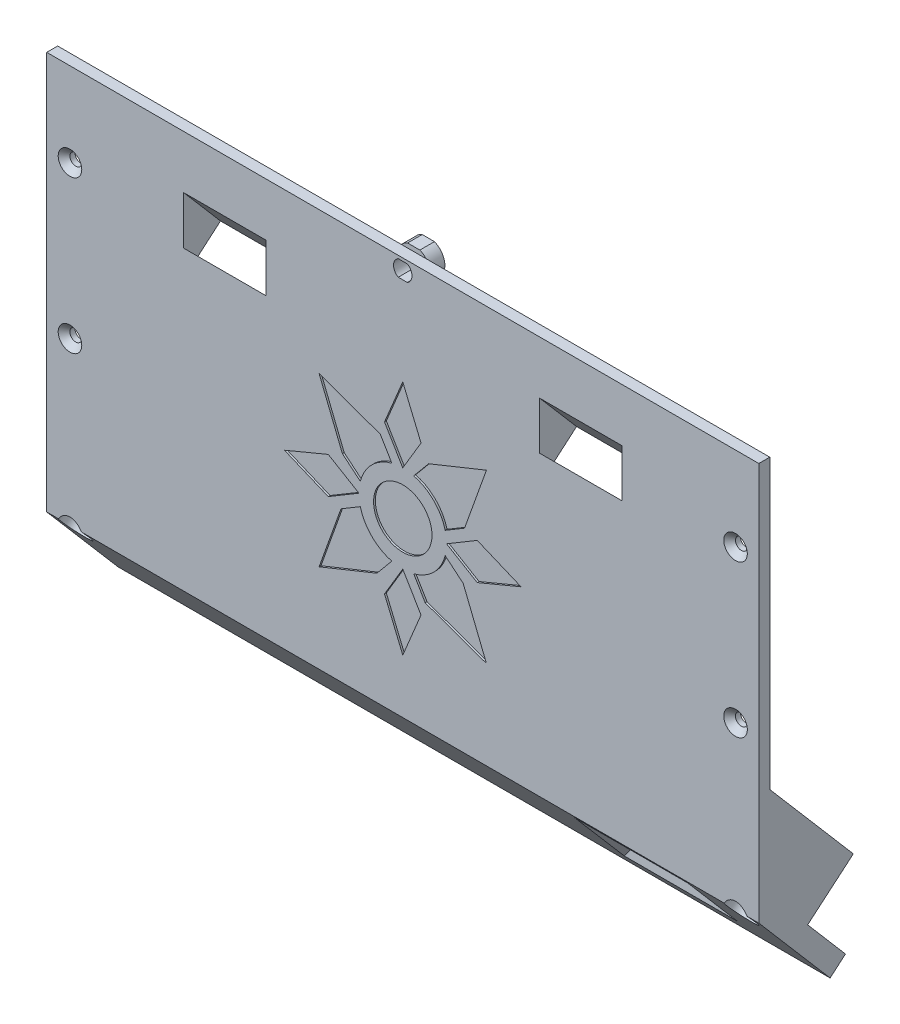
from build123d import *

# Parameters (mm, degrees)
CROQUIS1_W                  = 195
CROQUIS1_H                  = 38
CROQUIS1_R                  = 1.625
SALIENTE_EXTRUIR1_DEPTH     = 3
CROQUIS8_W                  = 195
CROQUIS8_H                  = 3
SALIENTE_EXTRUIR5_DEPTH     = 5
CROQUIS9_W                  = 195
CROQUIS9_H                  = 3
SALIENTE_EXTRUIR6_DEPTH     = 5
SALIENTE_EXTRUIR7_START     = -35
SALIENTE_EXTRUIR7_DEPTH     = 35
CORTAR_EXTRUIR4_DEPTH       = 106.249773968
CORTAR_EXTRUIR4_DEPTH_BACK  = 106.249773968
CROQUIS11_W                 = 22.5
CROQUIS11_H                 = 8.5
CORTAR_EXTRUIR5_REACH       = 168.049
CROQUIS13_R                 = 1
CORTAR_EXTRUIR6_DEPTH       = 5
SALIENTE_EXTRUIR8_START     = -35
SALIENTE_EXTRUIR8_DEPTH     = 35
CORTAR_EXTRUIR7_DEPTH       = 105.027363957
CORTAR_EXTRUIR7_DEPTH_BACK  = 105.027363957
CROQUIS16_W                 = 22.5
CROQUIS16_H                 = 8.572274099
CROQUIS17_R                 = 1
CORTAR_EXTRUIR8_DEPTH       = 5
CROQUIS18_R                 = 1.625
CORTAR_EXTRUIR9_DEPTH       = 10
CROQUIS19_W                 = 195
CROQUIS19_H                 = 24
SALIENTE_EXTRUIR9_DEPTH     = 3
CROQUIS20_W                 = 195
CROQUIS20_H                 = 28.69
SALIENTE_EXTRUIR10_DEPTH    = 3
CROQUIS22_W                 = 195
CROQUIS22_H                 = 8.799275258
CROQUIS22_W_2               = 10.817472397
CROQUIS22_H_2               = 9.408992843
CROQUIS22_W_3               = 11.057059306
SALIENTE_EXTRUIR11_DEPTH    = 3
CROQUIS23_R                 = 1.625
CORTAR_EXTRUIR10_DEPTH      = 10
CORTAR_EXTRUIR11_DEPTH      = 202.915168907
CORTAR_EXTRUIR11_DEPTH_BACK = 202.915168907
CROQUIS25_W                 = 6.04831912
CROQUIS25_H                 = 14.575165693
SALIENTE_EXTRUIR15_DEPTH    = 12.75
SALIENTE_EXTRUIR16_DEPTH    = 12.75
CROQUIS27_W                 = 3
CROQUIS27_H                 = 30
SALIENTE_EXTRUIR13_DEPTH    = 195
SALIENTE_EXTRUIR14_DEPTH    = 195
CORTAR_EXTRUIR12_DEPTH      = 125.253856914
CORTAR_EXTRUIR12_DEPTH_BACK = 125.253856914
CROQUIS31_R                 = 1.625
SALIENTE_EXTRUIR17_DEPTH    = 12.75
SALIENTE_EXTRUIR18_DEPTH    = 12.75
CORTAR_EXTRUIR15_DEPTH      = 125.560379507
CORTAR_EXTRUIR15_DEPTH_BACK = 125.560379507
CROQUIS39_R                 = 1.625
CORTAR_EXTRUIR16_START      = -4
CROQUIS40_R                 = 4
CORTAR_EXTRUIR16_DEPTH      = 121.560379507
SALIENTE_EXTRUIR19_START    = -15
SALIENTE_EXTRUIR19_DEPTH    = 4
CHAFL_N1_SIZE               = 10
SALIENTE_EXTRUIR20_DEPTH    = 3
CORTAR_EXTRUIR17_REACH      = 139.659
CROQUIS47_W                 = 25
CROQUIS47_H                 = 15
CORTAR_EXTRUIR18_REACH      = 132.012
CROQUIS49_R                 = 8
CORTAR_EXTRUIR19_DEPTH      = 0.5
CHAFL_N2_SIZE               = 3
SALIENTE_EXTRUIR22_DEPTH    = 4
CHAFL_N3_SIZE               = 1.6


with BuildPart() as part:
    # Croquis1 → Saliente-Extruir1 (new body)
    with BuildSketch(Plane.XY):
        with Locations((0, 19)):
            Rectangle(CROQUIS1_W, CROQUIS1_H)
        with Locations((91.125, 15)):
            Circle(CROQUIS1_R, mode=Mode.SUBTRACT)
        with Locations(Location((-91.125, 15, 0), (0, 0, 180))):
            Circle(CROQUIS1_R, mode=Mode.SUBTRACT)
    extrude(amount=SALIENTE_EXTRUIR1_DEPTH)

    # Croquis8 → Saliente-Extruir5 (add)
    with BuildSketch(Plane.XZ):
        with Locations((0, 1.5)):
            Rectangle(CROQUIS8_W, CROQUIS8_H)
    extrude(amount=SALIENTE_EXTRUIR5_DEPTH)

    # Croquis9 → Saliente-Extruir6 (add)
    with BuildSketch(Plane(origin=(0, 38, 0), x_dir=(1, 0, 0), z_dir=(0, 1, 0))):
        with Locations((0, -1.5)):
            Rectangle(CROQUIS9_W, CROQUIS9_H)
    extrude(amount=SALIENTE_EXTRUIR6_DEPTH)

    # Croquis10 → Saliente-Extruir7 (add)
    with BuildSketch(Plane(origin=(97.5, 0, 0), x_dir=(0, 0, -1), z_dir=(1, 0, 0)).offset(SALIENTE_EXTRUIR7_START)):
        Polygon((0, 35.316843742), (11.100559408, 22.365598856), (1.230032412, 13.905534031), (0, 12.851268747), align=None)
    extrude(amount=-SALIENTE_EXTRUIR7_DEPTH)

    # Croquis11 → Cortar-Extruir4 (cut, two sides: drawn at the far end of the back side and taken through both)
    with BuildSketch(Plane(origin=(0, 7.408665422, 6.349994257), x_dir=(1, 0, 0), z_dir=(0, -0.7592713073348797, -0.6507742172658522)).offset(-CORTAR_EXTRUIR4_DEPTH_BACK)):
        with Locations((48.75, -17.733291342)):
            Rectangle(CROQUIS11_W, CROQUIS11_H)
    extrude(amount=CORTAR_EXTRUIR4_DEPTH + CORTAR_EXTRUIR4_DEPTH_BACK, mode=Mode.SUBTRACT)

    # Croquis12 → Cortar-Extruir5 (cut, up to next)
    with BuildSketch(Plane(origin=(62.5, 0, 0), x_dir=(0, 0, -1), z_dir=(1, 0, 0)), mode=Mode.PRIVATE) as cortar_extruir5_sk1:
        Polygon((11.100559408, 22.365598856), (0, 12.851268747), (0, 19.436530105), (7.846688321, 26.161955392), align=None)
    cortar_extruir5_tool1 = extrude(cortar_extruir5_sk1.sketch, amount=-CORTAR_EXTRUIR5_REACH, mode=Mode.PRIVATE) & part.part
    add(cortar_extruir5_tool1.solids().sort_by_distance((62.5, 20.055266, -4.783378))[0], mode=Mode.SUBTRACT)

    # Croquis13 → Cortar-Extruir6 (cut)
    with BuildSketch(Plane(origin=(0, 11.205021959, 9.603865343), x_dir=(1, 0, 0), z_dir=(0, -0.7592713073348788, -0.6507742172658535))):
        with Locations(Location((33.75, -17.823291342, 0), (0, 0, 270))):
            Circle(CROQUIS13_R)
    extrude(amount=-CORTAR_EXTRUIR6_DEPTH, mode=Mode.SUBTRACT)

    # Croquis14 → Saliente-Extruir8 (add)
    with BuildSketch(Plane.ZY.offset(97.5).offset(SALIENTE_EXTRUIR8_START)):
        Polygon((0, 19.436530105), (-7.846688321, 26.161955392), (0, 35.316843742), align=None)
    extrude(amount=-SALIENTE_EXTRUIR8_DEPTH)

    # Croquis16 → Cortar-Extruir7 (cut, two sides: drawn at the far end of the back side and taken through both)
    with BuildSketch(Plane(origin=(0, 11.205021959, 9.603865343), x_dir=(1, 0, 0), z_dir=(0, -0.7592713073348788, -0.6507742172658535)).offset(-CORTAR_EXTRUIR7_DEPTH_BACK)):
        with Locations((-48.75, -17.697154293)):
            Rectangle(CROQUIS16_W, CROQUIS16_H)
    extrude(amount=CORTAR_EXTRUIR7_DEPTH + CORTAR_EXTRUIR7_DEPTH_BACK, mode=Mode.SUBTRACT)

    # Croquis17 → Cortar-Extruir8 (cut)
    with BuildSketch(Plane(origin=(0, 11.205021959, 9.603865343), x_dir=(1, 0, 0), z_dir=(0, -0.7592713073348788, -0.6507742172658535))):
        with Locations(Location((-33.75, -17.823291342, 0), (0, 0, 90))):
            Circle(CROQUIS17_R)
    extrude(amount=-CORTAR_EXTRUIR8_DEPTH, mode=Mode.SUBTRACT)

    # Croquis18 → Cortar-Extruir9 (cut)
    with BuildSketch(Plane.XY.offset(3)):
        with Locations((91.125, 23)):
            Circle(CROQUIS18_R)
        with Locations((-91.125, 23)):
            Circle(CROQUIS18_R)
    extrude(amount=-CORTAR_EXTRUIR9_DEPTH, mode=Mode.SUBTRACT)

    # Croquis19 → Saliente-Extruir9 (add)
    with BuildSketch(Plane.XY.offset(3)):
        with Locations((0, 7)):
            Rectangle(CROQUIS19_W, CROQUIS19_H)
    extrude(amount=-SALIENTE_EXTRUIR9_DEPTH)

    # Croquis20 → Saliente-Extruir10 (add)
    with BuildSketch(Plane.XY.offset(3)):
        with Locations((0, -19.345)):
            Rectangle(CROQUIS20_W, CROQUIS20_H)
    extrude(amount=-SALIENTE_EXTRUIR10_DEPTH)

    # Croquis22 → Saliente-Extruir11 (add)
    with BuildSketch(Plane.XY.offset(3)):
        with Locations((0, 47.399637629)):
            Rectangle(CROQUIS22_W, CROQUIS22_H)
        with Locations((-92.091263802, 22.840486177)):
            Rectangle(CROQUIS22_W_2, CROQUIS22_H_2)
        with Locations((91.971470347, 22.840486177)):
            Rectangle(CROQUIS22_W_3, CROQUIS22_H_2)
    extrude(amount=-SALIENTE_EXTRUIR11_DEPTH)

    # Croquis23 → Cortar-Extruir10 (cut)
    with BuildSketch(Plane.XY.offset(3)):
        with Locations((-91.125, 28.799275258)):
            Circle(CROQUIS23_R)
        with Locations((-91.125, -12.890724742)):
            Circle(CROQUIS23_R)
        with Locations((91.125, -12.890724742)):
            Circle(CROQUIS23_R)
        with Locations((91.125, 28.799275258)):
            Circle(CROQUIS23_R)
    extrude(amount=-CORTAR_EXTRUIR10_DEPTH, mode=Mode.SUBTRACT)

    # Croquis25 → Cortar-Extruir11 (cut, two sides: drawn at the far end of the back side and taken through both)
    with BuildSketch(Plane.ZY.offset(97.5).offset(-CORTAR_EXTRUIR11_DEPTH_BACK)):
        with Locations((3.02415956, -34.488307588)):
            Rectangle(CROQUIS25_W, CROQUIS25_H)
    extrude(amount=CORTAR_EXTRUIR11_DEPTH + CORTAR_EXTRUIR11_DEPTH_BACK, mode=Mode.SUBTRACT)

    # Croquis29 → Saliente-Extruir15 (add)
    with BuildSketch(Plane(origin=(97.5, 0, 0), x_dir=(0, 0, -1), z_dir=(1, 0, 0))):
        Polygon((-3, -27.200724742), (21.04761885, -55.257563071), (22.868084319, -53.697235453), (-1.179534531, -25.640397124), align=None)
    extrude(amount=-SALIENTE_EXTRUIR15_DEPTH)

    # Croquis30 → Saliente-Extruir16 (add)
    with BuildSketch(Plane.ZY.offset(97.5)):
        Polygon((0, -27.200724742), (3, -27.200724742), (-21.04761885, -55.257563071), (-22.868084319, -53.697235453), align=None)
    extrude(amount=-SALIENTE_EXTRUIR16_DEPTH)

    # Croquis27 → Saliente-Extruir13 (add)
    with BuildSketch(Plane(origin=(97.5, 0, 0), x_dir=(0, 0, -1), z_dir=(1, 0, 0))):
        with Locations((-1.5, -42.200724742)):
            Rectangle(CROQUIS27_W, CROQUIS27_H)
    extrude(amount=-SALIENTE_EXTRUIR13_DEPTH)

    # Croquis28 → Saliente-Extruir14 (add)
    with BuildSketch(Plane(origin=(97.5, 0, 0), x_dir=(0, 0, -1), z_dir=(1, 0, 0))):
        Polygon((20.723276226, -76.378985981), (0, -52.200724742), (0, -57.200724742), (-3, -57.200724742), (16.523226518, -79.978863962), align=None)
        Polygon((0, -57.200724742), (0, -52.200724742), (-3, -54.772035726), (-3, -57.200724742), align=None)
    extrude(amount=-SALIENTE_EXTRUIR14_DEPTH)

    # Croquis31 → Cortar-Extruir12 (cut, two sides: drawn at the far end of the back side and taken through both)
    with BuildSketch(Plane(origin=(0, -13.002042132, 15.169742848), x_dir=(1, 0, 0), z_dir=(0, -0.6507742172658533, 0.7592713073348789)).offset(-CORTAR_EXTRUIR12_DEPTH_BACK)):
        with Locations(Location((91.125, -43.962916807, 0), (0, 0, 270))):
            Circle(CROQUIS31_R)
        with Locations(Location((-91.125, -43.962916807, 0), (0, 0, 270))):
            Circle(CROQUIS31_R)
    extrude(amount=CORTAR_EXTRUIR12_DEPTH + CORTAR_EXTRUIR12_DEPTH_BACK, mode=Mode.SUBTRACT)

    # Croquis32 → Saliente-Extruir17 (add)
    with BuildSketch(Plane(origin=(97.5, 0, 0), x_dir=(0, 0, -1), z_dir=(1, 0, 0))):
        Polygon((0, -30.7008848), (21.04761885, -55.257563071), (10.361638113, -64.289855362), (0, -52.200724742), align=None)
    extrude(amount=-SALIENTE_EXTRUIR17_DEPTH)

    # Croquis33 → Saliente-Extruir18 (add)
    with BuildSketch(Plane.ZY.offset(97.5)):
        Polygon((0, -30.7008848), (0, -52.200724742), (-10.361638113, -64.289855362), (-21.04761885, -55.257563071), align=None)
    extrude(amount=-SALIENTE_EXTRUIR18_DEPTH)

    # Croquis39 → Cortar-Extruir15 (cut, two sides: drawn at the far end of the back side and taken through both)
    with BuildSketch(Plane(origin=(0, -11.441714514, 13.349277379), x_dir=(-1, 0, 0), z_dir=(0, 0.6507742172658534, -0.7592713073348788)).offset(-CORTAR_EXTRUIR15_DEPTH_BACK)):
        with Locations(Location((91.125, -43.962916807, 0), (0, 0, 270))):
            Circle(CROQUIS39_R)
        with Locations(Location((-91.125, -43.962916807, 0), (0, 0, 270))):
            Circle(CROQUIS39_R)
    extrude(amount=CORTAR_EXTRUIR15_DEPTH + CORTAR_EXTRUIR15_DEPTH_BACK, mode=Mode.SUBTRACT)

    # Croquis40 → Cortar-Extruir16 (cut, through all)
    with BuildSketch(Plane(origin=(0, -11.441714514, 13.349277379), x_dir=(-1, 0, 0), z_dir=(0, 0.6507742172658534, -0.7592713073348788)).offset(CORTAR_EXTRUIR16_START)):
        with Locations(Location((-91.125, -43.962916807, 0), (0, 0, 90))):
            Circle(CROQUIS40_R)
        with Locations(Location((91.125, -43.962916807, 0), (0, 0, 90))):
            Circle(CROQUIS40_R)
    extrude(amount=-CORTAR_EXTRUIR16_DEPTH, mode=Mode.SUBTRACT)

    # Croquis43 → Saliente-Extruir19 (add)
    with BuildSketch(Plane(origin=(0, -54.271609374, -46.516395087), x_dir=(1, 0, 0), z_dir=(0, -0.7592713073348788, -0.6507742172658533)).offset(SALIENTE_EXTRUIR19_START)):
        with BuildLine():
            Line((-10, 33.970885785), (10, 33.970885785))
            Line((10, 33.970885785), (10, 23.970885785))
            Line((10, 23.970885785), (3.75, 23.970885785))
            Line((3.75, 23.970885785), (3.75, 28.970885785))
            ThreePointArc((3.75, 28.970885785), (0, 32.720885785), (-3.75, 28.970885785))
            Line((-3.75, 28.970885785), (-3.75, 23.970885785))
            Line((-3.75, 23.970885785), (-10, 23.970885785))
            Line((-10, 23.970885785), (-10, 33.970885785))
        make_face()
    extrude(amount=-SALIENTE_EXTRUIR19_DEPTH)

    # Chaflán1
    chafl_n1_edges = [part.edges().sort_by_distance(p)[0] for p in [
        (-10, -63.471373756, -9.660114532),
        (10, -63.471373756, -9.660114532),
    ]]
    chamfer(chafl_n1_edges, length=CHAFL_N1_SIZE - 0.0001)  # a hair under: the kernel refuses the full size

    # Croquis44 → Saliente-Extruir20 (add)
    with BuildSketch(Plane.ZY.offset(97.5)):
        Polygon((-28.627825889, -60.417241249), (-16.183984406, -71.082903342), (-10.361638113, -64.289855362), (-22.868084319, -53.697235453), align=None)
    extrude(amount=-SALIENTE_EXTRUIR20_DEPTH)

    # Croquis47 → Cortar-Extruir17 (cut, up to next)
    with BuildSketch(Plane(origin=(0, -25.707254588, 29.993168569), x_dir=(1, 0, 0), z_dir=(0, -0.6507742172658535, 0.7592713073348788)), mode=Mode.PRIVATE) as cortar_extruir17_sk1:
        with Locations((61.232763252, -53.978546404)):
            Rectangle(CROQUIS47_W, CROQUIS47_H)
    cortar_extruir17_tool1 = extrude(cortar_extruir17_sk1.sketch, amount=-CORTAR_EXTRUIR17_REACH, mode=Mode.PRIVATE) & part.part
    add(cortar_extruir17_tool1.solids().sort_by_distance((61.232763, -66.691616, -5.134678))[0], mode=Mode.SUBTRACT)

    # Croquis48 → Cortar-Extruir18 (cut, up to next)
    with BuildSketch(Plane.XY.offset(3), mode=Mode.PRIVATE) as cortar_extruir18_sk1:
        with BuildLine():
            Line((1.239203373, 50.999275258), (-1.239203373, 50.999275258))
            ThreePointArc((-1.239203373, 50.999275258), (-2.431884027, 49.478661068), (-2.2, 47.560071885))
            ThreePointArc((-2.2, 47.560071885), (-1.785444622, 47.013830635), (-1.239203373, 46.599275258))
            Line((-1.239203373, 46.599275258), (1.239203373, 46.599275258))
            ThreePointArc((1.239203373, 46.599275258), (2.525, 48.799275258), (1.239203373, 50.999275258))
        make_face()
    cortar_extruir18_tool1 = extrude(cortar_extruir18_sk1.sketch, amount=-CORTAR_EXTRUIR18_REACH, mode=Mode.PRIVATE) & part.part
    add(cortar_extruir18_tool1.solids().sort_by_distance((0, 48.799275, 3))[0], mode=Mode.SUBTRACT)

    # Croquis49 → Cortar-Extruir19 (cut)
    with BuildSketch(Plane.XY.offset(3)):
        with BuildLine():
            ThreePointArc((-11.618950039, -7), (-8.485281374, -1.514718626), (-3, 1.618950039))
            Line((-3, 1.618950039), (-6.154064033, 6.9153036))
            Line((-6.154064033, 6.9153036), (-22.907486476, 12.907486476))
            Line((-22.907486476, 12.907486476), (-16.537602787, -2.893123467))
            Line((-16.537602787, -2.893123467), (-11.618950039, -7))
        make_face()
        Polygon((0, 2), (-5, 10.396078054), (0, 22.396078054), (5, 10.396078054), align=None)
        with BuildLine():
            Line((7.106876533, 6.537602787), (3, 1.618950039))
            ThreePointArc((3, 1.618950039), (8.485281374, -1.514718626), (11.618950039, -7))
            Line((11.618950039, -7), (16.9153036, -3.845935967))
            Line((16.9153036, -3.845935967), (22.907486476, 12.907486476))
            Line((22.907486476, 12.907486476), (7.106876533, 6.537602787))
        make_face()
        Polygon((12, -10), (20.396078054, -15), (32.396078054, -10), (20.396078054, -5), align=None)
        with BuildLine():
            Line((16.537602787, -17.106876533), (11.618950039, -13))
            ThreePointArc((11.618950039, -13), (8.485281374, -18.485281374), (3, -21.618950039))
            Line((3, -21.618950039), (6.154064033, -26.9153036))
            Line((6.154064033, -26.9153036), (22.907486476, -32.907486476))
            Line((22.907486476, -32.907486476), (16.537602787, -17.106876533))
        make_face()
        with Locations((0, -10)):
            Circle(CROQUIS49_R)
        Polygon((0, -22), (-5, -30.396078054), (0, -42.396078054), (5, -30.396078054), align=None)
        with BuildLine():
            ThreePointArc((-3, -21.618950039), (-8.485281374, -18.485281374), (-11.618950039, -13))
            Line((-11.618950039, -13), (-16.9153036, -16.154064033))
            Line((-16.9153036, -16.154064033), (-22.907486476, -32.907486476))
            Line((-22.907486476, -32.907486476), (-7.106876533, -26.537602787))
            Line((-7.106876533, -26.537602787), (-3, -21.618950039))
        make_face()
        Polygon((-12, -10), (-20.396078054, -5), (-32.396078054, -10), (-20.396078054, -15), align=None)
    extrude(amount=-CORTAR_EXTRUIR19_DEPTH, mode=Mode.SUBTRACT)

    # Chaflán2
    chafl_n2_edges = [part.edges().sort_by_distance(p)[0] for p in [
        (48.732763252, -66.691616084, -5.134677716),
        (61.232763252, -72.386150889, -10.015484345),
        (73.732763252, -66.691616084, -5.134677716),
        (61.232763252, -60.997081279, -0.253871086),
    ]]
    chamfer(chafl_n2_edges, length=CHAFL_N2_SIZE)

    # Croquis51 → Saliente-Extruir22 (add)
    with BuildSketch(Plane(origin=(0, 0, 0), x_dir=(-1, 0, 0), z_dir=(0, 0, -1))):
        with BuildLine():
            Line((-1.683931412, 44.599275258), (1.683931412, 44.599275258))
            ThreePointArc((1.683931412, 44.599275258), (4.525, 48.799275258), (1.683931412, 52.999275258))
            Line((1.683931412, 52.999275258), (-1.683931412, 52.999275258))
            ThreePointArc((-1.683931412, 52.999275258), (-4.525, 48.799275258), (-1.683931412, 44.599275258))
        make_face()
        with BuildLine():
            Line((-1.239203373, 46.599275258), (1.239203373, 46.599275258))
            ThreePointArc((1.239203373, 46.599275258), (2.525, 48.799275258), (1.239203373, 50.999275258))
            Line((1.239203373, 50.999275258), (-1.239203373, 50.999275258))
            ThreePointArc((-1.239203373, 50.999275258), (-2.525, 48.799275258), (-1.239203373, 46.599275258))
        make_face(mode=Mode.SUBTRACT)
    extrude(amount=SALIENTE_EXTRUIR22_DEPTH)

    # Chaflán3
    chafl_n3_edges = [part.edges().sort_by_distance(p)[0] for p in [
        (89.5, 28.799275258, 3),
        (89.5, -12.890724742, 3),
        (-92.75, -12.890724742, 3),
        (-92.75, 28.799275258, 3),
    ]]
    chamfer(chafl_n3_edges, length=CHAFL_N3_SIZE)


solid = part.part
